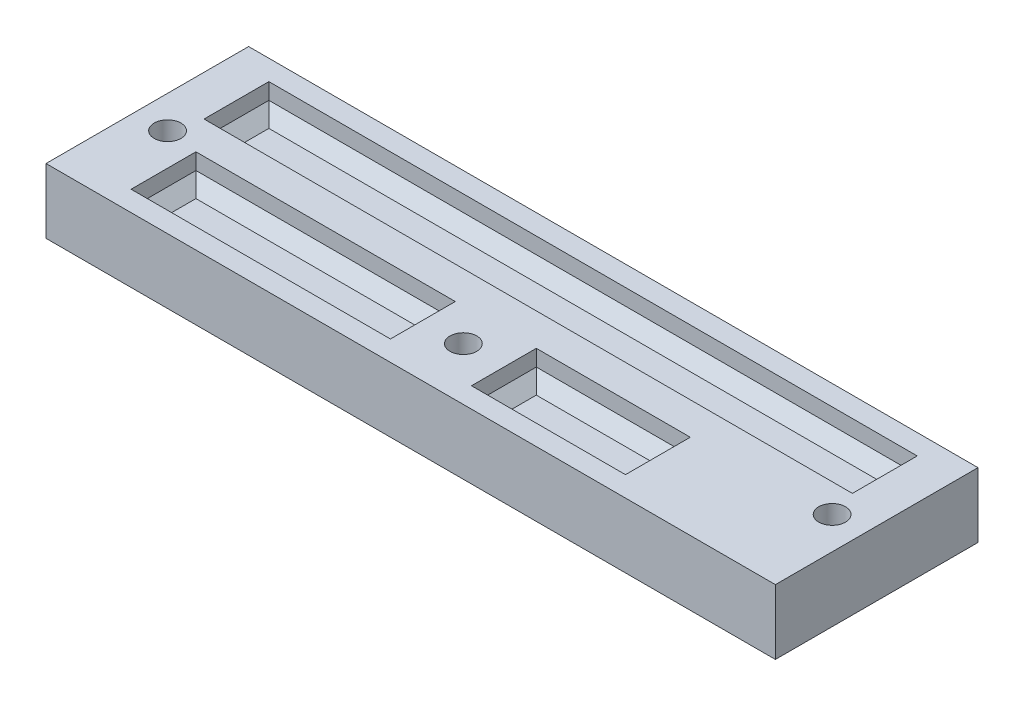
from build123d import *

# Parameters (mm, degrees)
ESQUISSE1_W             = 90
ESQUISSE1_H             = 25
BOSS_EXTRU_1_DEPTH      = 8
ESQUISSE3_R             = 1.65
ENL_V_MAT_EXTRU_1_DEPTH = 48.384069053
ESQUISSE4_R             = 3.25
ENL_V_MAT_EXTRU_2_DEPTH = 4
EMPREINTE1_START        = -10
EMPREINTE1_DEPTH        = 8
EMPREINTE1_START_2      = 2
EMPREINTE1_2_DEPTH      = 8
EMPREINTE1_START_3      = -38.94589
EMPREINTE1_3_DEPTH      = 77.9
EMPREINTE1_START_4      = -41
EMPREINTE1_4_DEPTH      = 82


with BuildPart() as part:
    # Esquisse1 → Boss.-Extru.1 (new body)
    with BuildSketch(Plane(origin=(0, 0, 0), x_dir=(1, 0, 0), z_dir=(0, 1, 0))):
        Rectangle(ESQUISSE1_W, ESQUISSE1_H)
    extrude(amount=BOSS_EXTRU_1_DEPTH)

    # Esquisse3 → Enlèv. mat.-Extru.1 (cut, through all)
    with BuildSketch(Plane(origin=(0, 8, 0), x_dir=(1, 0, 0), z_dir=(0, 1, 0))):
        with Locations(Location((0, -6, 0), (0, 0, 270))):
            Circle(ESQUISSE3_R)
        with Locations(Location((41, -1.5, 0), (0, 0, 270))):
            Circle(ESQUISSE3_R)
        with Locations(Location((-41, -1.5, 0), (0, 0, 270))):
            Circle(ESQUISSE3_R)
    extrude(amount=-ENL_V_MAT_EXTRU_1_DEPTH, mode=Mode.SUBTRACT)

    # Esquisse4 → Enlèv. mat.-Extru.2 (cut)
    with BuildSketch(Plane.XZ):
        with Locations(Location((-41, 1.5, 0), (0, 0, 270))):
            Circle(ESQUISSE4_R)
        with Locations(Location((41, 1.5, 0), (0, 0, 270))):
            Circle(ESQUISSE4_R)
        with Locations(Location((0, 6, 0), (0, 0, 270))):
            Circle(ESQUISSE4_R)
    extrude(amount=-ENL_V_MAT_EXTRU_2_DEPTH, mode=Mode.SUBTRACT)

    # Empreinte1: read off the stored shape, not the designer's step
    # Empreinte1 outline → Empreinte1 (cut)
    with BuildSketch(Plane.XY.offset(EMPREINTE1_START)):
        Polygon((40, 8), (-40, 8), (-40, 6), (-38.5, 4.5), (38.5, 4.5), (40, 6), align=None)
    extrude(amount=EMPREINTE1_DEPTH, mode=Mode.SUBTRACT)

    # Empreinte1 2 outline → Empreinte1 2 (cut)
    with BuildSketch(Plane.XY.offset(EMPREINTE1_START_2)):
        Polygon((6.5, 4.5), (22.5, 4.5), (24, 6), (24, 8), (5, 8), (5, 6), align=None)
        Polygon((-35.5, 4.5), (-6.5, 4.5), (-5, 6), (-5, 8), (-37, 8), (-37, 6), align=None)
    extrude(amount=EMPREINTE1_2_DEPTH, mode=Mode.SUBTRACT)

    # Empreinte1 3 outline → Empreinte1 3 (add)
    with BuildSketch(Plane.YZ.offset(EMPREINTE1_START_3)):
        Polygon((4.5, 2), (6, 2), (4.5, 3.5), align=None)
        Polygon((4.5, 10), (4.5, 8.5), (6, 10), align=None)
        Polygon((6, -10), (4.5, -8.5), (4.5, -10), align=None)
        Polygon((4.5, -2), (4.5, -3.5), (6, -2), align=None)
    extrude(amount=EMPREINTE1_3_DEPTH)

    # Empreinte1 4 outline → Empreinte1 4 (add)
    with BuildSketch(Plane.YZ.offset(EMPREINTE1_START_4)):
        Polygon((6, -10), (4.5, -8.5), (4.5, -10), align=None)
        Polygon((4.5, -2), (4.5, -3.5), (6, -2), align=None)
    extrude(amount=EMPREINTE1_4_DEPTH)


solid = part.part
